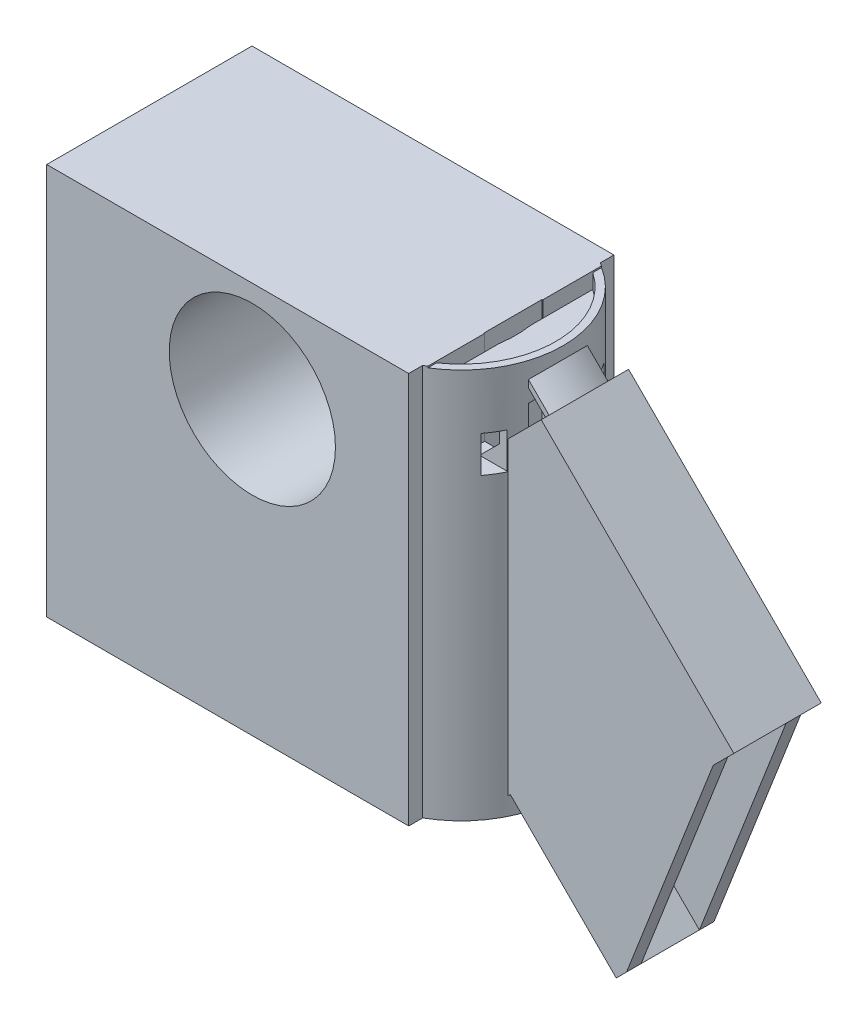
from build123d import *
from build123d.topology import SkipClean

# Parameters (mm, degrees)
BOSS_EXTRUDE1_DEPTH      = 10.16
SKETCH2_R                = 12.7
CUT_EXTRUDE1_DEPTH       = 15.24
SKETCH4_R                = 17.78
BOSS_EXTRUDE5_DEPTH      = 29.21
BOSS_EXTRUDE6_START      = 17.018
SKETCH10_R               = 17.78
BOSS_EXTRUDE6_DEPTH      = 17.018
SKETCH11_R               = 16.51
CUT_EXTRUDE3_DEPTH       = 25.4
BOSS_EXTRUDE7_START      = 15.494
SKETCH13_R               = 16.51
BOSS_EXTRUDE7_DEPTH      = 15.494
BOSS_EXTRUDE8_START      = 15.494
SKETCH12_R               = 17.78
SKETCH12_R_2             = 16.51
BOSS_EXTRUDE8_DEPTH      = 15.494
SKETCH14_W               = 180.239115116
SKETCH14_H               = 151.262520824
CUT_EXTRUDE4_DEPTH       = 127
CUT_EXTRUDE5_DEPTH       = 10.16
SKETCH17_W               = 81.28
SKETCH17_H               = 45.72
BOSS_EXTRUDE9_DEPTH      = 12.7
SKETCH22_W               = 45.72
SKETCH22_H               = 12.7
BOSS_EXTRUDE10_DEPTH     = 5.08
SKETCH21_W               = 48.5625
SKETCH21_H               = 21.463
CUT_EXTRUDE6_DEPTH       = 25.4
SKETCH21_2_W             = 48.5625
SKETCH21_2_H             = 21.463
CUT_EXTRUDE7_DEPTH       = 76.2
BOSS_EXTRUDE11_DEPTH     = 2.54
BOSS_EXTRUDE12_START     = 25.4
BOSS_EXTRUDE12_DEPTH     = 25.4
SKETCH28_W               = 48.5625
SKETCH28_H               = 21.463
BOSS_EXTRUDE13_DEPTH     = 19.65325
SKETCH30_W               = 23.256134839
SKETCH30_H               = 45.72
CUT_EXTRUDE8_DEPTH       = 179.161586335
BOSS_EXTRUDE14_DEPTH     = 2.54
BOSS_EXTRUDE20_DEPTH     = 2.54
SKETCH31_W               = 21.463
SKETCH31_H               = 6.35
CUT_EXTRUDE9_DEPTH       = 7.14375
CUT_EXTRUDE11_DEPTH      = 20.32
CUT_EXTRUDE12_START      = -32.512
CUT_EXTRUDE12_DEPTH      = 32.512
SKETCH40_W               = 63.103865161
SKETCH40_H               = 4.984473978
SKETCH40_H_2             = 4.951334437
CUT_EXTRUDE13_DEPTH      = 184.117970078
BOSS_EXTRUDE21_START     = 10.16
BOSS_EXTRUDE21_DEPTH     = 10.16
SKETCH42_W               = 17.505768479
SKETCH42_H               = 6.157778475
CUT_EXTRUDE14_DEPTH      = 184.247092498
SKETCH43_R               = 17.78
SKETCH43_R_2             = 16.51
BOSS_EXTRUDE22_DEPTH     = 42.672
SKETCH45_W               = 48.5625
SKETCH45_H               = 21.463
CUT_EXTRUDE15_DEPTH      = 99.06
CUT_EXTRUDE16_START      = -42.672
CUT_EXTRUDE16_DEPTH      = 42.672
BOSS_EXTRUDE23_START     = -42.672
BOSS_EXTRUDE23_DEPTH     = 42.672
CUT_EXTRUDE17_START      = -57.30875
CUT_EXTRUDE17_DEPTH      = 57.30875
BOSS_EXTRUDE24_DEPTH     = 27.432
BOSS_EXTRUDE27_DEPTH     = 2.54
CUT_EXTRUDE18_DEPTH      = 12.7
BOSS_EXTRUDE28_DEPTH     = 9.2
MIRROR7_COPY_1_DEPTH     = 2.54
CUT_EXTRUDE19_REACH      = 138.728
CUT_EXTRUDE19_END_RADIUS = 17.78
SKETCH54_W               = 10.16
SKETCH54_H               = 41.610978573
CUT_EXTRUDE20_DEPTH      = 192.522672227
SKETCH57_W               = 15.24
SKETCH57_H               = 9.39884981
CUT_EXTRUDE21_DEPTH      = 10.16
CUT_EXTRUDE22_REACH      = 196.09
CUT_EXTRUDE22_END_RADIUS = 17.78
SKETCH58_W               = 10.16
SKETCH58_H               = 40.64
BOSS_EXTRUDE30_DEPTH     = 35.56
CUT_EXTRUDE24_DEPTH      = 35.56
SKETCH62_W               = 10.16
SKETCH62_H               = 5.784762489
CUT_EXTRUDE25_DEPTH      = 35.56
SKETCH64_W               = 48.5625
SKETCH64_H               = 21.463
CUT_EXTRUDE26_DEPTH      = 84.48675
CUT_EXTRUDE27_DEPTH      = 0.566336227
CUT_EXTRUDE28_REACH      = 192.549
SKETCH66_W               = 2.54
SKETCH66_H               = 0.800920373
CUT_EXTRUDE29_REACH      = 192.549
SKETCH67_W               = 2.54
SKETCH67_H               = 0.800920373
SKETCH69_W               = 15.24
SKETCH69_H               = 47.49884981
BOSS_EXTRUDE32_DEPTH     = 2.54
CUT_EXTRUDE30_DEPTH      = 15.24
BOSS_EXTRUDE33_DEPTH     = 2.54
CUT_EXTRUDE31_DEPTH      = 36.632
CUT_EXTRUDE32_DEPTH      = 27.432
BOSS_EXTRUDE34_DEPTH     = 14.63675
BOSS_EXTRUDE35_DEPTH     = 30.226
SKETCH76_R               = 14.48943
CUT_EXTRUDE33_DEPTH      = 68.326


# Read off the part's stored shape, not the designer's step: Cut-Extrude5
with BuildPart() as part:
    # Sketch1 → Boss-Extrude1 (new body)
    with BuildSketch(Plane.XY):
        with BuildLine():
            Line((-103.272945392, -76.332177029), (-13.470384182, 13.470384182))
            ThreePointArc((-13.470384182, 13.470384182), (13.470384182, 13.470384182), (13.470384182, -13.470384182))
            Line((13.470384182, -13.470384182), (-76.332177029, -103.272945392))
            ThreePointArc((-76.332177029, -103.272945392), (-103.272945392, -103.272945392), (-103.272945392, -76.332177029))
        make_face()
        with BuildLine():
            Line((13.470384182, 13.470384182), (103.272945392, -76.332177029))
            ThreePointArc((103.272945392, -76.332177029), (103.272945392, -103.272945392), (76.332177029, -103.272945392))
            Line((76.332177029, -103.272945392), (-13.470384182, -13.470384182))
            ThreePointArc((-13.470384182, -13.470384182), (-13.470384182, 13.470384182), (13.470384182, 13.470384182))
        make_face()
    extrude(amount=BOSS_EXTRUDE1_DEPTH)

    # Sketch2 → Cut-Extrude1 (cut)
    with BuildSketch(Plane.XY.offset(10.16)):
        with Locations((-89.802561211, -89.802561211)):
            Circle(SKETCH2_R)
        with Locations((89.802561211, -89.802561211)):
            Circle(SKETCH2_R)
        Circle(SKETCH2_R)
    extrude(amount=-CUT_EXTRUDE1_DEPTH, mode=Mode.SUBTRACT)

    # Sketch4 → Boss-Extrude5 (add, symmetric)
    with BuildSketch(Plane(origin=(0, -78.74, 0), x_dir=(1, 0, 0), z_dir=(0, 1, 0))):
        with Locations(Location((-90.268950254, -4.90789503, 0), (0, 0, 16.02367852))):
            Circle(SKETCH4_R)
    extrude(amount=BOSS_EXTRUDE5_DEPTH, both=True)

    # Sketch10 → Boss-Extrude6 (add)
    with BuildSketch(Plane(origin=(0, -49.53, 0), x_dir=(1, 0, 0), z_dir=(0, 1, 0)).offset(BOSS_EXTRUDE6_START)):
        with Locations(Location((-90.268950254, -4.90789503, 0), (0, 0, 270))):
            Circle(SKETCH10_R)
    extrude(amount=-BOSS_EXTRUDE6_DEPTH)

    # Sketch11 → Cut-Extrude3 (cut)
    with BuildSketch(Plane(origin=(0, -32.512, 0), x_dir=(1, 0, 0), z_dir=(0, 1, 0))):
        with Locations(Location((-90.268950254, -4.90789503, 0), (0, 0, 270))):
            Circle(SKETCH11_R)
    extrude(amount=-CUT_EXTRUDE3_DEPTH, mode=Mode.SUBTRACT)

    # Sketch13 → Boss-Extrude7 (add)
    with BuildSketch(Plane(origin=(0, -57.912, 0), x_dir=(1, 0, 0), z_dir=(0, 1, 0)).offset(BOSS_EXTRUDE7_START)):
        with Locations(Location((-90.268950254, -4.90789503, 0), (0, 0, 270))):
            Circle(SKETCH13_R)
    extrude(amount=-BOSS_EXTRUDE7_DEPTH)

    # Sketch12 → Boss-Extrude8 (add)
    with BuildSketch(Plane(origin=(0, -32.512, 0), x_dir=(1, 0, 0), z_dir=(0, 1, 0)).offset(BOSS_EXTRUDE8_START)):
        with Locations(Location((-90.268950254, -4.90789503, 0), (0, 0, 270))):
            Circle(SKETCH12_R)
        with Locations(Location((-90.268950254, -4.90789503, 0), (0, 0, 270))):
            Circle(SKETCH12_R_2, mode=Mode.SUBTRACT)
    extrude(amount=-BOSS_EXTRUDE8_DEPTH)

    # Sketch14 → Cut-Extrude4 (cut, symmetric)
    with BuildSketch(Plane.XY):
        with Locations((25.764355825, -37.475896132)):
            Rectangle(SKETCH14_W, SKETCH14_H)
    extrude(amount=CUT_EXTRUDE4_DEPTH, both=True, mode=Mode.SUBTRACT)

    # Cut-Extrude5 outline → Cut-Extrude5 (cut)
    with BuildSketch(Plane.XY):
        Polygon((-81.058478118, -54.117709755), (-81.058478118, -107.95), (-81.009231637, -107.95), (-64.355201733, -91.295970096), (-64.355201733, -37.414433369), (-72.488950254, -45.548181891), align=None)
    extrude(amount=CUT_EXTRUDE5_DEPTH, mode=Mode.SUBTRACT)

    # Sketch17 → Boss-Extrude9 (add)
    with BuildSketch(Plane(origin=(0, -107.95, 0), x_dir=(-1, 0, 0), z_dir=(0, -1, 0))):
        with Locations((122.146835995, -4.90789503)):
            Rectangle(SKETCH17_W, SKETCH17_H)
    extrude(amount=-BOSS_EXTRUDE9_DEPTH)

    # Sketch22 → Boss-Extrude10 (add)
    with BuildSketch(Plane.ZY.offset(162.786835995)):
        with Locations((4.90789503, -101.6)):
            Rectangle(SKETCH22_W, SKETCH22_H)
    extrude(amount=BOSS_EXTRUDE10_DEPTH)

    # Sketch21 → Cut-Extrude6 (cut)
    with BuildSketch(Plane(origin=(0, -78.74, 0), x_dir=(1, 0, 0), z_dir=(0, 1, 0))):
        with Locations((-105.788085995, -4.90789503)):
            Rectangle(SKETCH21_W, SKETCH21_H)
    extrude(amount=-CUT_EXTRUDE6_DEPTH, mode=Mode.SUBTRACT)

    # Sketch21<2> → Cut-Extrude7 (cut)
    with BuildSketch(Plane(origin=(0, -78.74, 0), x_dir=(1, 0, 0), z_dir=(0, 1, 0))):
        with Locations((-105.788085995, -4.90789503)):
            Rectangle(SKETCH21_2_W, SKETCH21_2_H)
    extrude(amount=CUT_EXTRUDE7_DEPTH, mode=Mode.SUBTRACT)

    # Sketch25 → Boss-Extrude11 (add)
    with BuildSketch(Plane(origin=(-13.470384182, 13.470384182, 0), x_dir=(0, 0, -1), z_dir=(0.7071067811865482, -0.7071067811865468, 0))):
        with BuildLine():
            Line((0, -84.441786622), (0, -56.812208992))
            Line((0, -56.812208992), (-10.16, -56.812208992))
            Line((-10.16, -56.812208992), (-10.16, -84.586926338))
            add(Edge.make_bspline(
                [(0, -84.441786622), (-5.095299919, -82.372321424), (-10.16, -84.586926338)],
                knots=[2.861926705, 2.861926705, 2.861926705, 3.441460529, 3.441460529, 3.441460529], degree=2, weights=[1, 0.958310502, 1]))
        make_face()
    boss_extrude11 = extrude(amount=-BOSS_EXTRUDE11_DEPTH)

    # Sketch26 → Boss-Extrude12 (add)
    with BuildSketch(Plane(origin=(0, -95.25, 0), x_dir=(1, 0, 0), z_dir=(0, 1, 0)).offset(BOSS_EXTRUDE12_START)):
        with BuildLine():
            Line((-104.445103038, -15.63939503), (-130.069335995, -15.63939503))
            Line((-130.069335995, -15.63939503), (-130.069335995, 5.82360497))
            Line((-130.069335995, 5.82360497), (-104.445103038, 5.82360497))
            ThreePointArc((-104.445103038, 5.82360497), (-93.866701613, 12.504301419), (-81.506835995, 10.563166786))
            Line((-81.506835995, 10.563166786), (-81.506835995, 17.95210497))
            Line((-81.506835995, 17.95210497), (-167.866835995, 17.95210497))
            Line((-167.866835995, 17.95210497), (-167.866835995, -27.76789503))
            Line((-167.866835995, -27.76789503), (-81.506835995, -27.76789503))
            Line((-81.506835995, -27.76789503), (-81.506835995, -20.378956846))
            ThreePointArc((-81.506835995, -20.378956846), (-93.866701613, -22.320091478), (-104.445103038, -15.63939503))
        make_face()
    extrude(amount=-BOSS_EXTRUDE12_DEPTH)

    # Sketch28 → Boss-Extrude13 (add)
    with BuildSketch(Plane(origin=(0, -104.14, 0), x_dir=(1, 0, 0), z_dir=(0, 1, 0))):
        with Locations((-105.788085995, -4.90789503)):
            Rectangle(SKETCH28_W, SKETCH28_H)
    extrude(amount=BOSS_EXTRUDE13_DEPTH)

    # Sketch30 → Cut-Extrude8 (cut, through all)
    with BuildSketch(Plane(origin=(0, -69.85, 0), x_dir=(1, 0, 0), z_dir=(0, 1, 0))):
        with Locations((-156.238768575, -4.90789503)):
            Rectangle(SKETCH30_W, SKETCH30_H)
    extrude(amount=-CUT_EXTRUDE8_DEPTH, mode=Mode.SUBTRACT)



with BuildPart() as body_2:
    # Sketch32 → Boss-Extrude14 (new body)
    with BuildSketch(Plane(origin=(13.470384182, -13.470384182, 0), x_dir=(0, 0, 1), z_dir=(-0.7071067811865482, 0.7071067811865468, 0))):
        with BuildLine():
            Line((10.16, -122.686926338), (10.16, -73.541331439))
            Line((10.16, -73.541331439), (0, -73.541331439))
            Line((0, -73.541331439), (0, -122.541786622))
            add(Edge.make_bspline(
                [(10.16, -122.686926338), (5.095299919, -120.472321424), (0, -122.541786622)],
                knots=[2.841724778, 2.841724778, 2.841724778, 3.421258602, 3.421258602, 3.421258602], degree=2, weights=[1, 0.958310502, 1]))
        make_face()
    extrude(amount=-BOSS_EXTRUDE14_DEPTH)


with BuildPart() as part_1:
    add(part.part)

    add(body_2.part)  # Boss-Extrude20 merges body 2
    # Sketch35 → Boss-Extrude20 (add)
    with BuildSketch(Plane(origin=(15.266435406, -15.266435406, 0), x_dir=(0, 0, -1), z_dir=(0.7071067811865483, -0.7071067811865468, 0))):
        with BuildLine():
            Line((-10.16, -122.686926338), (-10.16, -125.720399301))
            Line((-10.16, -125.720399301), (0, -125.720399301))
            Line((0, -125.720399301), (0, -122.541786622))
            add(Edge.make_bspline(
                [(0, -122.541786622), (-5.095299919, -120.472321424), (-10.16, -122.686926338)],
                knots=[2.861926705, 2.861926705, 2.861926705, 3.441460529, 3.441460529, 3.441460529], degree=2, weights=[1, 0.958310502, 1]))
        make_face()
    extrude(amount=-BOSS_EXTRUDE20_DEPTH)

    # Sketch31 → Cut-Extrude9 (cut)
    with BuildSketch(Plane.ZY.offset(81.506835995)):
        with Locations((4.90789503, -52.73675)):
            Rectangle(SKETCH31_W, SKETCH31_H)
    extrude(amount=-CUT_EXTRUDE9_DEPTH, mode=Mode.SUBTRACT)

    # Sketch36 → Cut-Extrude11 (cut)
    with BuildSketch(Plane(origin=(0, -17.018, 0), x_dir=(1, 0, 0), z_dir=(0, 1, 0))):
        with BuildLine():
            Line((-104.445103038, 5.82360497), (-102.815464023, 5.82360497))
            ThreePointArc((-102.815464023, 5.82360497), (-73.758950254, -4.90789503), (-102.815464023, -15.63939503))
            Line((-102.815464023, -15.63939503), (-104.445103038, -15.63939503))
            ThreePointArc((-104.445103038, -15.63939503), (-72.488950254, -4.90789503), (-104.445103038, 5.82360497))
        make_face()
    extrude(amount=-CUT_EXTRUDE11_DEPTH, mode=Mode.SUBTRACT)

    # Sketch37 → Cut-Extrude12 (cut)
    with BuildSketch(Plane(origin=(0, -37.338, 0), x_dir=(1, 0, 0), z_dir=(0, 1, 0)).offset(CUT_EXTRUDE12_START)):
        Polygon((-122.742327405, 5.82360497), (-99.596896622, 5.82360497), (-99.596896622, 16.253986564), (-107.395348164, 16.253986564), align=None)
        Polygon((-107.996603625, -15.63939503), (-99.596896622, -15.63939503), (-99.596896622, -26.769851753), (-107.676926206, -26.769851753), align=None)
    extrude(amount=CUT_EXTRUDE12_DEPTH, mode=Mode.SUBTRACT)

    # Sketch40 → Cut-Extrude13 (cut, through all)
    with BuildSketch(Plane(origin=(0, 0, 0), x_dir=(1, 0, 0), z_dir=(0, 1, 0))):
        with Locations((-113.058768576, 15.459867981)):
            Rectangle(SKETCH40_W, SKETCH40_H)
        with Locations((-113.058768576, -25.292227812)):
            Rectangle(SKETCH40_W, SKETCH40_H_2)
    extrude(amount=-CUT_EXTRUDE13_DEPTH, mode=Mode.SUBTRACT)

    # Sketch41 → Boss-Extrude21 (add)
    with BuildSketch(Plane(origin=(0, -37.338, 0), x_dir=(1, 0, 0), z_dir=(0, 1, 0)).offset(BOSS_EXTRUDE21_START)):
        with BuildLine():
            Line((-99.596896622, 10.228743189), (-99.596896622, 8.714495236))
            ThreePointArc((-99.596896622, 8.714495236), (-73.758950254, -4.90789503), (-99.596896622, -18.530285295))
            Line((-99.596896622, -18.530285295), (-99.596896622, -20.044533248))
            ThreePointArc((-99.596896622, -20.044533248), (-72.488950254, -4.90789503), (-99.596896622, 10.228743189))
        make_face()
    extrude(amount=-BOSS_EXTRUDE21_DEPTH)

    # Sketch42 → Cut-Extrude14 (cut, through all)
    with BuildSketch(Plane(origin=(0, 0, 15.63939503), x_dir=(-1, 0, 0), z_dir=(0, 0, -1))):
        with Locations((89.981353516, -47.096275962)):
            Rectangle(SKETCH42_W, SKETCH42_H)
    extrude(amount=-CUT_EXTRUDE14_DEPTH, mode=Mode.SUBTRACT)

    # Sketch43 → Boss-Extrude22 (add)
    with BuildSketch(Plane(origin=(0, -69.85, 0), x_dir=(1, 0, 0), z_dir=(0, 1, 0))):
        with Locations((-98.506835995, -4.90789503)):
            Circle(SKETCH43_R)
        with Locations((-98.506835995, -4.90789503)):
            Circle(SKETCH43_R_2, mode=Mode.SUBTRACT)
    extrude(amount=BOSS_EXTRUDE22_DEPTH)

    # Sketch45 → Cut-Extrude15 (cut)
    with BuildSketch(Plane(origin=(0, -84.48675, 0), x_dir=(1, 0, 0), z_dir=(0, 1, 0))):
        with Locations((-105.788085995, -4.90789503)):
            Rectangle(SKETCH45_W, SKETCH45_H)
    extrude(amount=CUT_EXTRUDE15_DEPTH, mode=Mode.SUBTRACT)

    # Sketch46 → Cut-Extrude16 (cut)
    with BuildSketch(Plane(origin=(0, -27.178, 0), x_dir=(1, 0, 0), z_dir=(0, 1, 0)).offset(CUT_EXTRUDE16_START)):
        Polygon((-80.940499768, 19.580248661), (-80.940499768, -25.682883351), (-105.528188403, -25.682883351), (-105.528188403, 17.859442688), align=None)
    extrude(amount=CUT_EXTRUDE16_DEPTH, mode=Mode.SUBTRACT)

    # Sketch47 → Boss-Extrude23 (add)
    with BuildSketch(Plane(origin=(0, -27.178, 0), x_dir=(1, 0, 0), z_dir=(0, 1, 0)).offset(BOSS_EXTRUDE23_START)):
        with BuildLine():
            Line((-85.960322226, 5.82360497), (-84.330683211, 5.82360497))
            ThreePointArc((-84.330683211, 5.82360497), (-93.962903834, 12.281668098), (-105.528188403, 11.427006573))
            Line((-105.528188403, 11.427006573), (-105.528188403, 10.034685416))
            ThreePointArc((-105.528188403, 10.034685416), (-95.03334328, 11.232580439), (-85.960322226, 5.82360497))
        make_face()
        with BuildLine():
            Line((-85.960322226, -15.63939503), (-84.330683211, -15.63939503))
            ThreePointArc((-84.330683211, -15.63939503), (-93.962903834, -22.097458157), (-105.528188403, -21.242796632))
            Line((-105.528188403, -21.242796632), (-105.528188403, -19.850475475))
            ThreePointArc((-105.528188403, -19.850475475), (-95.03334328, -21.048370498), (-85.960322226, -15.63939503))
        make_face()
    extrude(amount=BOSS_EXTRUDE23_DEPTH)

    # Sketch48 → Cut-Extrude17 (cut)
    with BuildSketch(Plane(origin=(0, -27.178, 0), x_dir=(1, 0, 0), z_dir=(0, 1, 0)).offset(CUT_EXTRUDE17_START)):
        with BuildLine():
            Line((-80.940499768, -2.159762653), (-80.940499768, -7.656027407))
            ThreePointArc((-80.940499768, -7.656027407), (-80.726835995, -4.90789503), (-80.940499768, -2.159762653))
        make_face()
    extrude(amount=CUT_EXTRUDE17_DEPTH, mode=Mode.SUBTRACT)

    # Sketch49 → Boss-Extrude24 (add)
    with BuildSketch(Plane(origin=(0, -69.85, 0), x_dir=(1, 0, 0), z_dir=(0, 1, 0))):
        with BuildLine():
            Line((-111.053349764, 5.82360497), (-85.960322226, 5.82360497))
            ThreePointArc((-85.960322226, 5.82360497), (-98.506835995, 11.60210497), (-111.053349764, 5.82360497))
        make_face()
        with BuildLine():
            Line((-85.960322226, -15.63939503), (-111.053349764, -15.63939503))
            ThreePointArc((-111.053349764, -15.63939503), (-98.506835995, -21.41789503), (-85.960322226, -15.63939503))
        make_face()
    extrude(amount=BOSS_EXTRUDE24_DEPTH)

    # Sketch50 → Boss-Extrude27 (add)
    with BuildSketch(Plane.XY.offset(10.16)):
        Polygon((-75.770102644, -45.237231832), (-55.438733639, -24.905862827), (-53.642682414, -26.701914051), (-38.531189977, -65.47195834), (-36.735138752, -67.268009564), (-75.770102644, -106.302973455), align=None)
    boss_extrude27 = extrude(amount=BOSS_EXTRUDE27_DEPTH)

    # Mirror1: Boss-Extrude27 across plane
    add(boss_extrude27.mirror(Plane(origin=(0, 0, 5.08), x_dir=(1, 0, 0), z_dir=(0, 0, -1))))

    # Sketch52 → Cut-Extrude18 (cut)
    with BuildSketch(Plane(origin=(0, -27.178, 0), x_dir=(1, 0, 0), z_dir=(0, 1, 0))):
        with BuildLine():
            Line((-80.940499768, -18.529940086), (-80.940499768, -20.044222574))
            ThreePointArc((-80.940499768, -20.044222574), (-72.488950254, -4.90789503), (-80.940499768, 10.228432515))
            Line((-80.940499768, 10.228432515), (-80.940499768, 8.714150027))
            ThreePointArc((-80.940499768, 8.714150027), (-73.758950254, -4.90789503), (-80.940499768, -18.529940086))
        make_face()
    extrude(amount=-CUT_EXTRUDE18_DEPTH, mode=Mode.SUBTRACT)

    # Sketch53 → Boss-Extrude28 (add)
    with BuildSketch(Plane(origin=(0, -27.178, 0), x_dir=(1, 0, 0), z_dir=(0, 1, 0))):
        with BuildLine():
            Line((-85.960322226, 5.82360497), (-84.330683211, 5.82360497))
            ThreePointArc((-84.330683211, 5.82360497), (-98.506835995, 12.87210497), (-112.682988779, 5.82360497))
            Line((-112.682988779, 5.82360497), (-111.053349764, 5.82360497))
            ThreePointArc((-111.053349764, 5.82360497), (-98.506835995, 11.60210497), (-85.960322226, 5.82360497))
        make_face()
        with BuildLine():
            Line((-84.330683211, -15.63939503), (-85.960322226, -15.63939503))
            ThreePointArc((-85.960322226, -15.63939503), (-98.506835995, -21.41789503), (-111.053349764, -15.63939503))
            Line((-111.053349764, -15.63939503), (-112.682988779, -15.63939503))
            ThreePointArc((-112.682988779, -15.63939503), (-98.506835995, -22.68789503), (-84.330683211, -15.63939503))
        make_face()
    extrude(amount=BOSS_EXTRUDE28_DEPTH)

    # Mirror7: Boss-Extrude11, Boss-Extrude27 across plane
    add(boss_extrude11.mirror(Plane(origin=(0, -73.914, 0), x_dir=(0, 0, 1), z_dir=(0, -1, 0))))
    add(boss_extrude27.mirror(Plane(origin=(0, -73.914, 0), x_dir=(0, 0, 1), z_dir=(0, -1, 0))))

    # Mirror7 copy 1 sketch → Mirror7 copy 1 (add)
    with BuildSketch(Plane(origin=(0, -147.828, 0), x_dir=(1, 0, 0), z_dir=(0, 0, -1))):
        Polygon((-75.770102644, -45.237231832), (-55.438733639, -24.905862827), (-53.642682414, -26.701914051), (-38.531189977, -65.47195834), (-36.735138752, -67.268009564), (-75.770102644, -106.302973455), align=None)
    extrude(amount=MIRROR7_COPY_1_DEPTH)

    # Cut-Extrude19: up to this cylinder (the profile starts outside it)
    with SkipClean():  # the faces are left unmerged after this step: merging them gives an invalid solid
        cut_extrude19_end = Plane(origin=(-90.268950254, -46.086936, 4.90789503), z_dir=(0, -1, 0)) * Cylinder(CUT_EXTRUDE19_END_RADIUS, 314.016, mode=Mode.PRIVATE)
        # Sketch54 → Cut-Extrude19 (cut, up to the surface)
        with BuildSketch(Plane(origin=(-55.603003281, -21.672514928, 0), x_dir=(0, 0, -1), z_dir=(0.9317263284323525, 0.36316118860083085, 0)), mode=Mode.PRIVATE) as cut_extrude19_sk1:
            Polygon((2.54, -47.008914609), (2.54, -5.397936036), (2.54, -3.072251725), (-12.7, -3.072251725), (-12.7, -5.397936036), (-12.7, -47.008914609), (-12.7, -49.334598919), (2.54, -49.334598919), align=None)
            with Locations((-5.08, -26.203425322)):
                Rectangle(SKETCH54_W, SKETCH54_H, mode=Mode.SUBTRACT)
        cut_extrude19_tool1 = extrude(cut_extrude19_sk1.sketch, amount=-CUT_EXTRUDE19_REACH, mode=Mode.PRIVATE) - cut_extrude19_end
        add(cut_extrude19_tool1.solids().sort_by_distance((-46.086936, -46.086936, -2.052921))[0], mode=Mode.SUBTRACT)

    # Sketch56 → Cut-Extrude20 (cut, through all)
    with SkipClean():  # the faces are left unmerged after this step: merging them gives an invalid solid
        with BuildSketch(Plane.XY.offset(12.7)):
            Polygon((-74.287351456, -81.904824886), (-74.287351456, -101.22811982), (-42.570213114, -69.510981478), align=None)
        extrude(amount=-CUT_EXTRUDE20_DEPTH, mode=Mode.SUBTRACT)

    # Sketch57 → Cut-Extrude21 (cut)
    with SkipClean():  # the faces are left unmerged after this step: merging them gives an invalid solid
        with BuildSketch(Plane(origin=(15.266435406, -15.266435406, 0), x_dir=(0, 0, -1), z_dir=(0.7071067811865482, -0.7071067811865468, 0))):
            with Locations((-5.08, -78.240756344)):
                Rectangle(SKETCH57_W, SKETCH57_H)
        extrude(amount=-CUT_EXTRUDE21_DEPTH, mode=Mode.SUBTRACT)

    # Cut-Extrude22: up to this cylinder (the profile starts outside it)
    with SkipClean():  # the faces are left unmerged after this step: merging them gives an invalid solid
        cut_extrude22_end = Plane(origin=(-90.268950254, -88.28241, 4.90789503), z_dir=(0, -1, 0)) * Cylinder(CUT_EXTRUDE22_END_RADIUS, 428.74, mode=Mode.PRIVATE)
        # Sketch58 → Cut-Extrude22 (cut, up to the surface)
        with BuildSketch(Plane(origin=(15.266435406, -15.266435406, 0), x_dir=(0, 0, -1), z_dir=(0.7071067811865482, -0.7071067811865468, 0)), mode=Mode.PRIVATE) as cut_extrude22_sk1:
            with Locations((-5.08, -103.260181249)):
                Rectangle(SKETCH58_W, SKETCH58_H)
        cut_extrude22_tool1 = extrude(cut_extrude22_sk1.sketch, amount=-CUT_EXTRUDE22_REACH, mode=Mode.PRIVATE) - cut_extrude22_end
        add(cut_extrude22_tool1.solids().sort_by_distance((-57.749539, -88.28241, 5.08))[0], mode=Mode.SUBTRACT)

    # Sketch59 → Boss-Extrude30 (add)
    with SkipClean():  # the faces are left unmerged after this step: merging them gives an invalid solid
        with BuildSketch(Plane(origin=(13.470384182, -13.470384182, 0), x_dir=(0, 0, 1), z_dir=(-0.7071067811865483, 0.7071067811865468, 0))):
            with BuildLine():
                Line((12.7, -82.940181249), (10.16, -82.940181249))
                Line((10.16, -82.940181249), (10.16, -122.686926338))
                add(Edge.make_bspline(
                    [(10.16, -122.686926338), (5.095299919, -120.472321424), (0, -122.541786622)],
                    knots=[2.841724778, 2.841724778, 2.841724778, 3.421258602, 3.421258602, 3.421258602], degree=2, weights=[1, 0.958310502, 1]))
                Line((0, -122.541786622), (0, -82.940181249))
                Line((0, -82.940181249), (-2.54, -82.940181249))
                Line((-2.54, -82.940181249), (-2.54, -123.87726066))
                add(Edge.make_bspline(
                    [(-2.54, -123.87726066), (-2.712979703, -123.990112535), (-2.884209941, -124.108179942)],
                    knots=[3.573817121, 3.573817121, 3.573817121, 3.595244725, 3.595244725, 3.595244725], degree=2, weights=[1, 0.999942608, 1]))
                Line((-2.884209941, -124.108179942), (0, -124.108179942))
                Line((0, -124.108179942), (0, -133.614354058))
                Line((0, -133.614354058), (10.16, -133.614354058))
                Line((10.16, -133.614354058), (10.16, -124.108179942))
                Line((10.16, -124.108179942), (12.7, -124.108179942))
                Line((12.7, -124.108179942), (12.7, -82.940181249))
            make_face()
        extrude(amount=BOSS_EXTRUDE30_DEPTH)

    # Sketch61 → Cut-Extrude24 (cut)
    with SkipClean():  # the faces are left unmerged after this step: merging them gives an invalid solid
        with BuildSketch(Plane(origin=(-15.266435406, 15.266435406, 0), x_dir=(0, 0, 1), z_dir=(-0.7071067811865483, 0.7071067811865468, 0))):
            with BuildLine():
                Line((0, -62.596971481), (0, -81.901786622))
                add(Edge.make_bspline(
                    [(10.16, -82.046926338), (5.095299919, -79.832321424), (0, -81.901786622)],
                    knots=[2.841724778, 2.841724778, 2.841724778, 3.421258602, 3.421258602, 3.421258602], degree=2, weights=[1, 0.958310502, 1]))
                Line((10.16, -82.046926338), (10.16, -62.596971481))
                Line((10.16, -62.596971481), (0, -62.596971481))
            make_face()
        extrude(amount=-CUT_EXTRUDE24_DEPTH, mode=Mode.SUBTRACT)


with BuildPart() as cut_extrude24_piece_1:
    # of the separate pieces the step leaves, piece 1, a body of its own (cut_extrude24_pieces)
    add(part_1.part.solids().sort_by_distance((-81.506835995, -69.85, 20.378956846))[0])

    # Sketch64 → Cut-Extrude26 (cut)
    with SkipClean():  # the faces are left unmerged after this step: merging them gives an invalid solid
        with BuildSketch(Plane(origin=(0, 0, 0), x_dir=(1, 0, 0), z_dir=(0, 1, 0))):
            with Locations((-105.788085995, -4.90789503)):
                Rectangle(SKETCH64_W, SKETCH64_H)
        extrude(amount=-CUT_EXTRUDE26_DEPTH, mode=Mode.SUBTRACT)

    # Sketch65 → Cut-Extrude27 (cut)
    with SkipClean():  # the faces are left unmerged after this step: merging them gives an invalid solid
        with BuildSketch(Plane.ZY.offset(81.506835995)):
            Polygon((15.63939503, -69.85), (12.7, -69.85), (12.7, -58.15817008), (10.16, -58.15817008), (10.16, -69.85), (0, -69.85), (0, -58.15817008), (-2.54, -58.15817008), (-2.54, -69.85), (-5.82360497, -69.85), (-5.82360497, -84.48675), (15.63939503, -84.48675), align=None)
        extrude(amount=-CUT_EXTRUDE27_DEPTH, mode=Mode.SUBTRACT)

    # Cut-Extrude28: up to this face of the body (flat: up to its plane)
    cut_extrude28_end = Plane(cut_extrude24_piece_1.part.faces().sort_by_distance((-80.940499768, -69.525687163, -8.026018743))[0])
    # Sketch66 → Cut-Extrude28 (cut, up to the picked face)
    with BuildSketch(Plane(origin=(-11.674332957, 11.674332957, 0), x_dir=(0, 0, 1), z_dir=(-0.7071067811865482, 0.7071067811865468, 0)), mode=Mode.PRIVATE) as cut_extrude28_sk1:
        with Locations((-1.27, -98.357612704)):
            Rectangle(SKETCH66_W, SKETCH66_H)
    cut_extrude28_tool1 = split(extrude(cut_extrude28_sk1.sketch, amount=-CUT_EXTRUDE28_REACH, mode=Mode.PRIVATE), bisect_by=cut_extrude28_end, keep=Keep.BOTH, mode=Mode.PRIVATE)
    add(cut_extrude28_tool1.solids().sort_by(Axis((-81.223668, -57.875002, -1.27), (0.7071067811865482, -0.7071067811865468, 0)))[0], mode=Mode.SUBTRACT)

    # Cut-Extrude29: up to this face of the body (flat: up to its plane)
    cut_extrude29_end = Plane(cut_extrude24_piece_1.part.faces().sort_by_distance((-80.940499768, -52.73675, 15.963707867))[0])
    # Sketch67 → Cut-Extrude29 (cut, up to the picked face)
    with BuildSketch(Plane(origin=(-11.674332957, 11.674332957, 0), x_dir=(0, 0, 1), z_dir=(-0.7071067811865482, 0.7071067811865468, 0)), mode=Mode.PRIVATE) as cut_extrude29_sk1:
        with Locations((11.43, -98.357612704)):
            Rectangle(SKETCH67_W, SKETCH67_H)
    cut_extrude29_tool1 = split(extrude(cut_extrude29_sk1.sketch, amount=-CUT_EXTRUDE29_REACH, mode=Mode.PRIVATE), bisect_by=cut_extrude29_end, keep=Keep.BOTH, mode=Mode.PRIVATE)
    add(cut_extrude29_tool1.solids().sort_by(Axis((-81.223668, -57.875002, 11.43), (0.7071067811865482, -0.7071067811865468, 0)))[0], mode=Mode.SUBTRACT)

    # Sketch69 → Boss-Extrude32 (add)
    with SkipClean():  # the faces are left unmerged after this step: merging them gives an invalid solid
        with BuildSketch(Plane(origin=(-58.647564594, -58.647564594, 0), x_dir=(0, 0, -1), z_dir=(0.7071067811865477, 0.7071067811865475, 0))):
            with Locations((-5.08, -7.239424905)):
                Rectangle(SKETCH69_W, SKETCH69_H)
        extrude(amount=BOSS_EXTRUDE32_DEPTH)

    # Sketch70 → Cut-Extrude30 (cut)
    with SkipClean():  # the faces are left unmerged after this step: merging them gives an invalid solid
        with BuildSketch(Plane(origin=(0, -17.978, 0), x_dir=(1, 0, 0), z_dir=(0, 1, 0))):
            with BuildLine():
                Line((-85.960322226, 5.82360497), (-84.330683211, 5.82360497))
                ThreePointArc((-84.330683211, 5.82360497), (-98.506835995, 12.87210497), (-112.682988779, 5.82360497))
                Line((-112.682988779, 5.82360497), (-111.053349764, 5.82360497))
                ThreePointArc((-111.053349764, 5.82360497), (-98.506835995, 11.60210497), (-85.960322226, 5.82360497))
            make_face()
            with BuildLine():
                Line((-84.330683211, -15.63939503), (-85.960322226, -15.63939503))
                ThreePointArc((-85.960322226, -15.63939503), (-98.506835995, -21.41789503), (-111.053349764, -15.63939503))
                Line((-111.053349764, -15.63939503), (-112.682988779, -15.63939503))
                ThreePointArc((-112.682988779, -15.63939503), (-98.506835995, -22.68789503), (-84.330683211, -15.63939503))
            make_face()
        extrude(amount=-CUT_EXTRUDE30_DEPTH, mode=Mode.SUBTRACT)

    # Sketch71 → Boss-Extrude33 (add)
    with SkipClean():  # the faces are left unmerged after this step: merging them gives an invalid solid
        with BuildSketch(Plane(origin=(-13.470384182, 13.470384182, 0), x_dir=(0, 0, -1), z_dir=(0.7071067811865483, -0.7071067811865468, 0))):
            with BuildLine():
                Line((0, -82.940181249), (0, -81.901786622))
                add(Edge.make_bspline(
                    [(0, -81.901786622), (-5.095299919, -79.832321424), (-10.16, -82.046926338)],
                    knots=[2.861926705, 2.861926705, 2.861926705, 3.441460529, 3.441460529, 3.441460529], degree=2, weights=[1, 0.958310502, 1]))
                Line((-10.16, -82.046926338), (-10.16, -82.940181249))
                Line((-10.16, -82.940181249), (0, -82.940181249))
            make_face()
        extrude(amount=BOSS_EXTRUDE33_DEPTH)

    # Sketch72 → Cut-Extrude31 (cut)
    with SkipClean():  # the faces are left unmerged after this step: merging them gives an invalid solid
        with BuildSketch(Plane(origin=(0, -33.218, 0), x_dir=(1, 0, 0), z_dir=(0, 1, 0))):
            with BuildLine():
                Line((-84.330683211, -15.63939503), (-85.960322226, -15.63939503))
                ThreePointArc((-85.960322226, -15.63939503), (-98.506835995, -21.41789503), (-111.053349764, -15.63939503))
                Line((-111.053349764, -15.63939503), (-112.682988779, -15.63939503))
                ThreePointArc((-112.682988779, -15.63939503), (-98.506835995, -22.68789503), (-84.330683211, -15.63939503))
            make_face()
            with BuildLine():
                Line((-85.960322226, 5.82360497), (-84.330683211, 5.82360497))
                ThreePointArc((-84.330683211, 5.82360497), (-98.506835995, 12.87210497), (-112.682988779, 5.82360497))
                Line((-112.682988779, 5.82360497), (-111.053349764, 5.82360497))
                ThreePointArc((-111.053349764, 5.82360497), (-98.506835995, 11.60210497), (-85.960322226, 5.82360497))
            make_face()
        extrude(amount=-CUT_EXTRUDE31_DEPTH, mode=Mode.SUBTRACT)

    # Sketch73 → Cut-Extrude32 (cut)
    with SkipClean():  # the faces are left unmerged after this step: merging them gives an invalid solid
        with BuildSketch(Plane(origin=(0, -42.418, 0), x_dir=(1, 0, 0), z_dir=(0, 1, 0))):
            with BuildLine():
                Line((-111.053349764, 5.82360497), (-85.960322226, 5.82360497))
                ThreePointArc((-85.960322226, 5.82360497), (-98.506835995, 11.60210497), (-111.053349764, 5.82360497))
            make_face()
            with BuildLine():
                Line((-85.960322226, -15.63939503), (-111.053349764, -15.63939503))
                ThreePointArc((-111.053349764, -15.63939503), (-98.506835995, -21.41789503), (-85.960322226, -15.63939503))
            make_face()
        extrude(amount=-CUT_EXTRUDE32_DEPTH, mode=Mode.SUBTRACT)

    # Sketch74 → Boss-Extrude34 (add)
    with SkipClean():  # the faces are left unmerged after this step: merging them gives an invalid solid
        with BuildSketch(Plane(origin=(0, -84.48675, 0), x_dir=(1, 0, 0), z_dir=(0, 1, 0))):
            Polygon((-130.069335995, -15.63939503), (-80.940499768, -15.63939503), (-80.940499768, -10.16), (-81.058478118, -10.16), (-81.058478118, 0), (-80.940499768, 0), (-80.940499768, 5.82360497), (-130.069335995, 5.82360497), align=None)
        extrude(amount=BOSS_EXTRUDE34_DEPTH)

    # Sketch75 → Boss-Extrude35 (add)
    with SkipClean():  # the faces are left unmerged after this step: merging them gives an invalid solid
        with BuildSketch(Plane(origin=(0, -69.85, 0), x_dir=(1, 0, 0), z_dir=(0, 1, 0))):
            with BuildLine():
                Line((-81.058478118, 0), (-80.940499768, 0))
                Line((-80.940499768, 0), (-80.940499768, 10.228432515))
                ThreePointArc((-80.940499768, 10.228432515), (-81.222119596, 10.398419192), (-81.506835995, 10.563166786))
                Line((-81.506835995, 10.563166786), (-81.506835995, 12.967630992))
                Line((-81.506835995, 12.967630992), (-144.610701156, 12.967630992))
                Line((-144.610701156, 12.967630992), (-144.610701156, -22.816560593))
                Line((-144.610701156, -22.816560593), (-81.506835995, -22.816560593))
                Line((-81.506835995, -22.816560593), (-81.506835995, -20.378956846))
                ThreePointArc((-81.506835995, -20.378956846), (-81.222119596, -20.214209251), (-80.940499768, -20.044222574))
                Line((-80.940499768, -20.044222574), (-80.940499768, -10.16))
                Line((-80.940499768, -10.16), (-81.058478118, -10.16))
                Line((-81.058478118, -10.16), (-81.058478118, 0))
            make_face()
        extrude(amount=BOSS_EXTRUDE35_DEPTH)

    # Sketch76 → Cut-Extrude33 (cut)
    with SkipClean():  # the faces are left unmerged after this step: merging them gives an invalid solid
        with BuildSketch(Plane.XY.offset(22.816560593)):
            with Locations((-108.766275945, -57.15)):
                Circle(SKETCH76_R)
        extrude(amount=-CUT_EXTRUDE33_DEPTH, mode=Mode.SUBTRACT)


with BuildPart() as cut_extrude24_piece_2:
    # of the separate pieces the step leaves, piece 2, a body of its own (cut_extrude24_pieces)
    add(part_1.part.solids().sort_by_distance((-53.642682414, -26.701914051, 0))[0])

    # Sketch62 → Cut-Extrude25 (cut)
    with BuildSketch(Plane(origin=(-13.470384182, 13.470384182, 0), x_dir=(0, 0, -1), z_dir=(0.7071067811865483, -0.7071067811865468, 0))):
        with Locations((-5.08, -59.704590237)):
            Rectangle(SKETCH62_W, SKETCH62_H)
    extrude(amount=-CUT_EXTRUDE25_DEPTH, mode=Mode.SUBTRACT)


solid = cut_extrude24_piece_1.part
